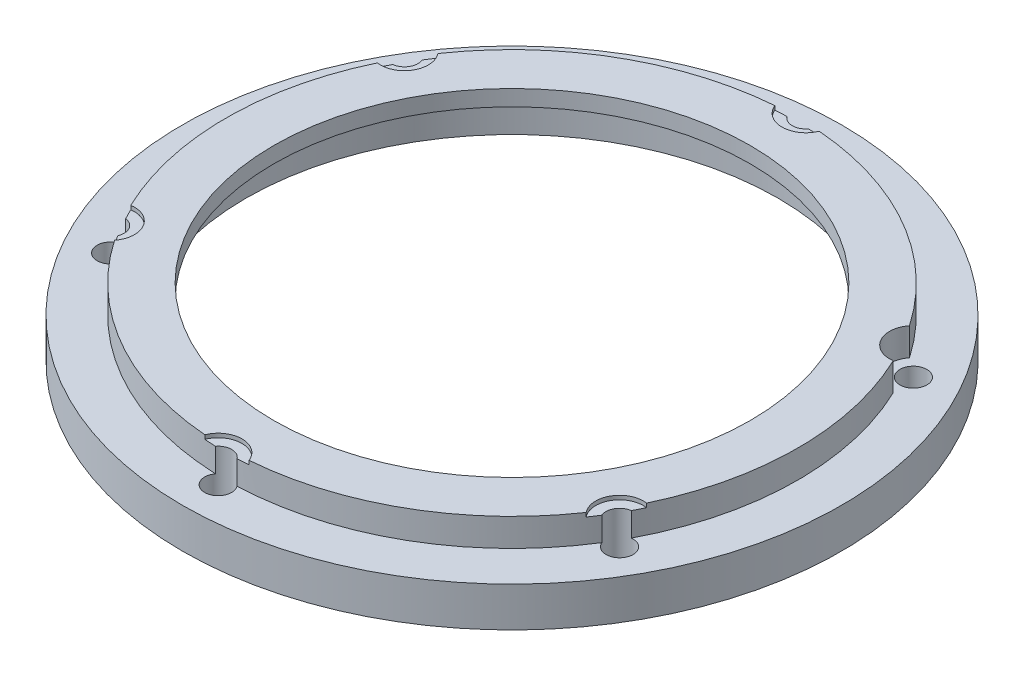
from build123d import *

# Parameters (mm, degrees)
SKETCH_3_R                      = 1.7
CUT_EXTRUDE_1_DEPTH             = 10
CUT_EXTRUDE_1_DIRECTION_2_REACH = 60.902
CUT_EXTRUDE_START               = 3
SKETCH_4_R                      = 3
CUT_EXTRUDE_2_DEPTH             = 3
SKETCH_7_R                      = 3
CUT_EXTRUDE_3_DEPTH             = 10


with BuildPart() as part:
    # 草图2 → 旋转1 (revolve)
    with BuildSketch(Plane(origin=(0, 0, 0), x_dir=(0, 0, -1), z_dir=(1, 0, 0))):
        Polygon((-30, 0), (-30, 2), (-36, 2), (-36, -1.5), (-41.5, -1.5), (-41.5, -6.5), (-35, -6.5), (-35, -5.5), (-33.5, -5.5), (-33.5, 0), align=None)
    revolve(axis=Axis((0, 0, 0), (0, 1, 0)))

    # 草图3 → 切除-拉伸1 (cut)
    with BuildSketch(Plane(origin=(0, -1.5, 0), x_dir=(1, 0, 0), z_dir=(0, 1, 0))):
        with Locations((0, 37)):
            Circle(SKETCH_3_R)
        with Locations((32.04293994, 18.5)):
            Circle(SKETCH_3_R)
        with Locations((32.04293994, -18.5)):
            Circle(SKETCH_3_R)
        with Locations((0, -37)):
            Circle(SKETCH_3_R)
        with Locations((-32.04293994, -18.5)):
            Circle(SKETCH_3_R)
        with Locations((-32.04293994, 18.5)):
            Circle(SKETCH_3_R)
    extrude(amount=-CUT_EXTRUDE_1_DEPTH, mode=Mode.SUBTRACT)

    # 草图3 → 切除-拉伸1 direction 2 (cut, up to next)
    with BuildSketch(Plane(origin=(0, -1.5, 0), x_dir=(1, 0, 0), z_dir=(0, 1, 0)), mode=Mode.PRIVATE) as cut_extrude_1_direction_2_sk1:
        with Locations((0, 37)):
            Circle(SKETCH_3_R)
    cut_extrude_1_direction_2_tool1 = extrude(cut_extrude_1_direction_2_sk1.sketch, amount=CUT_EXTRUDE_1_DIRECTION_2_REACH, mode=Mode.PRIVATE) & part.part
    # 草图3 → 切除-拉伸1 direction 2 (cut, up to next)
    with BuildSketch(Plane(origin=(0, -1.5, 0), x_dir=(1, 0, 0), z_dir=(0, 1, 0)), mode=Mode.PRIVATE) as cut_extrude_1_direction_2_sk2:
        with Locations((32.04293994, 18.5)):
            Circle(SKETCH_3_R)
    cut_extrude_1_direction_2_tool2 = extrude(cut_extrude_1_direction_2_sk2.sketch, amount=CUT_EXTRUDE_1_DIRECTION_2_REACH, mode=Mode.PRIVATE) & part.part
    # 草图3 → 切除-拉伸1 direction 2 (cut, up to next)
    with BuildSketch(Plane(origin=(0, -1.5, 0), x_dir=(1, 0, 0), z_dir=(0, 1, 0)), mode=Mode.PRIVATE) as cut_extrude_1_direction_2_sk3:
        with Locations((32.04293994, -18.5)):
            Circle(SKETCH_3_R)
    cut_extrude_1_direction_2_tool3 = extrude(cut_extrude_1_direction_2_sk3.sketch, amount=CUT_EXTRUDE_1_DIRECTION_2_REACH, mode=Mode.PRIVATE) & part.part
    # 草图3 → 切除-拉伸1 direction 2 (cut, up to next)
    with BuildSketch(Plane(origin=(0, -1.5, 0), x_dir=(1, 0, 0), z_dir=(0, 1, 0)), mode=Mode.PRIVATE) as cut_extrude_1_direction_2_sk4:
        with Locations((0, -37)):
            Circle(SKETCH_3_R)
    cut_extrude_1_direction_2_tool4 = extrude(cut_extrude_1_direction_2_sk4.sketch, amount=CUT_EXTRUDE_1_DIRECTION_2_REACH, mode=Mode.PRIVATE) & part.part
    # 草图3 → 切除-拉伸1 direction 2 (cut, up to next)
    with BuildSketch(Plane(origin=(0, -1.5, 0), x_dir=(1, 0, 0), z_dir=(0, 1, 0)), mode=Mode.PRIVATE) as cut_extrude_1_direction_2_sk5:
        with Locations((-32.04293994, -18.5)):
            Circle(SKETCH_3_R)
    cut_extrude_1_direction_2_tool5 = extrude(cut_extrude_1_direction_2_sk5.sketch, amount=CUT_EXTRUDE_1_DIRECTION_2_REACH, mode=Mode.PRIVATE) & part.part
    # 草图3 → 切除-拉伸1 direction 2 (cut, up to next)
    with BuildSketch(Plane(origin=(0, -1.5, 0), x_dir=(1, 0, 0), z_dir=(0, 1, 0)), mode=Mode.PRIVATE) as cut_extrude_1_direction_2_sk6:
        with Locations((-32.04293994, 18.5)):
            Circle(SKETCH_3_R)
    cut_extrude_1_direction_2_tool6 = extrude(cut_extrude_1_direction_2_sk6.sketch, amount=CUT_EXTRUDE_1_DIRECTION_2_REACH, mode=Mode.PRIVATE) & part.part
    add(cut_extrude_1_direction_2_tool1.solids().sort_by_distance((0, -1.5, -37))[0], mode=Mode.SUBTRACT)
    add(cut_extrude_1_direction_2_tool2.solids().sort_by_distance((32.04294, -1.5, -18.5))[0], mode=Mode.SUBTRACT)
    add(cut_extrude_1_direction_2_tool3.solids().sort_by_distance((32.04294, -1.5, 18.5))[0], mode=Mode.SUBTRACT)
    add(cut_extrude_1_direction_2_tool4.solids().sort_by_distance((0, -1.5, 37))[0], mode=Mode.SUBTRACT)
    add(cut_extrude_1_direction_2_tool5.solids().sort_by_distance((-32.04294, -1.5, 18.5))[0], mode=Mode.SUBTRACT)
    add(cut_extrude_1_direction_2_tool6.solids().sort_by_distance((-32.04294, -1.5, -18.5))[0], mode=Mode.SUBTRACT)

    # 草图4 → 切除-拉伸2 (cut)
    with BuildSketch(Plane(origin=(0, -1.5, 0), x_dir=(1, 0, 0), z_dir=(0, 1, 0)).offset(CUT_EXTRUDE_START)):
        with Locations((0, 37)):
            Circle(SKETCH_4_R)
        with Locations((32.04293994, 18.5)):
            Circle(SKETCH_4_R)
        with Locations((32.04293994, -18.5)):
            Circle(SKETCH_4_R)
        with Locations((0, -37)):
            Circle(SKETCH_4_R)
        with Locations((-32.04293994, -18.5)):
            Circle(SKETCH_4_R)
        with Locations((-32.04293994, 18.5)):
            Circle(SKETCH_4_R)
    extrude(amount=CUT_EXTRUDE_2_DEPTH, mode=Mode.SUBTRACT)

    # 草图7 → 切除-拉伸3 (cut)
    with BuildSketch(Plane(origin=(0, -1.5, 0), x_dir=(1, 0, 0), z_dir=(0, 1, 0))):
        with Locations((32.04293994, 18.5)):
            Circle(SKETCH_7_R)
    extrude(amount=CUT_EXTRUDE_3_DEPTH, mode=Mode.SUBTRACT)


solid = part.part
